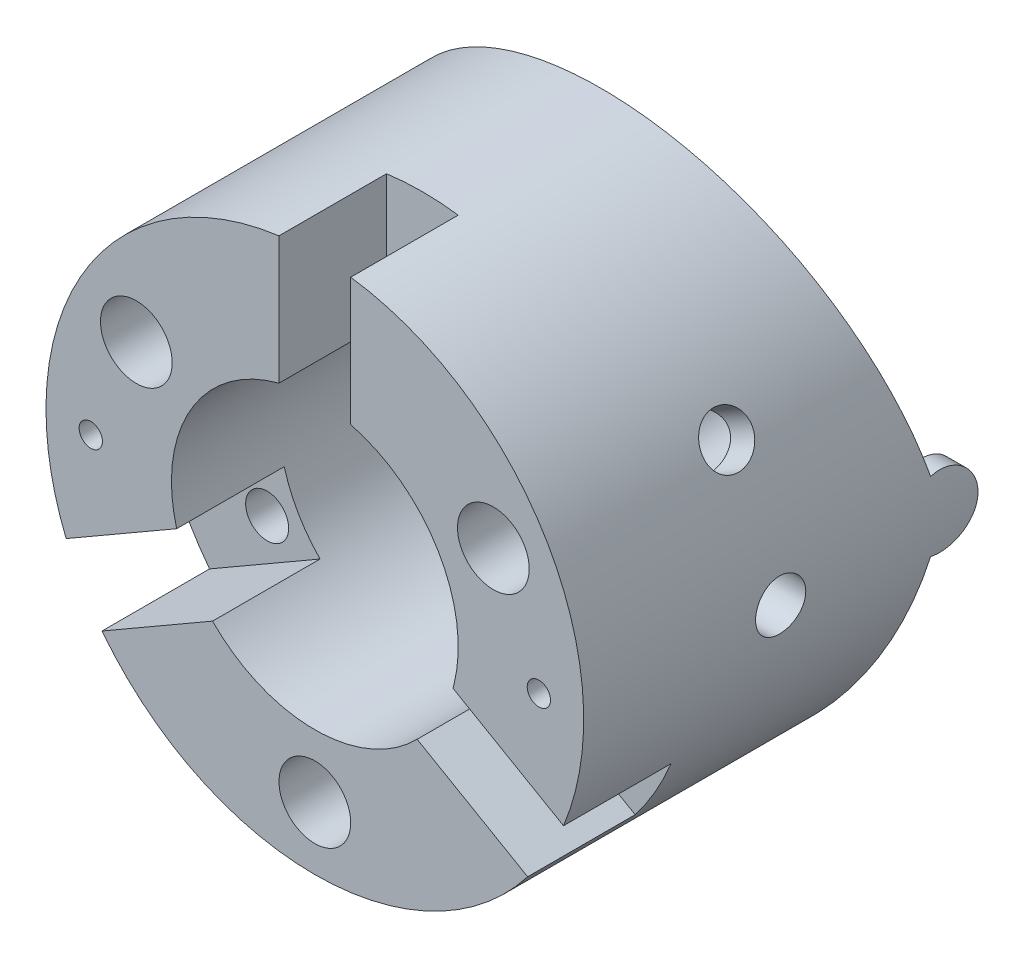
from build123d import *
from build123d.topology import SkipClean

# Parameters (mm, degrees)
SKETCH_1_R                       = 7.5
EXTRUDE_1_DEPTH                  = 10
SKETCH_2_R                       = 0.6
CUT_EXTRUDE_1_DEPTH              = 15.577379737
CUT_EXTRUDE_2_DEPTH              = 15.577379737
CUT_EXTRUDE_2_DEPTH_BACK         = 15.577379737
EXTRUDE_2_REACH                  = 16.577
EXTRUDE_2_END_RADIUS             = 7.5
SKETCH_4_R                       = 1
EXTRUDE_2_DIRECTION_2_REACH      = 16.577
EXTRUDE_2_DIRECTION_2_END_RADIUS = 7.5
SKETCH_5_R                       = 4
CUT_EXTRUDE_3_DEPTH              = 16.28070696
SKETCH_6_W                       = 2.5
SKETCH_6_H                       = 2
CUT_EXTRUDE_4_DEPTH              = 1
SKETCH_7_R                       = 0.325
CUT_EXTRUDE_5_DEPTH              = 16.28070696
SKETCH_8_W                       = 2
SKETCH_8_H                       = 5
CUT_EXTRUDE_6_DEPTH              = 3
CUT_EXTRUDE_7_REACH              = 18.077
CUT_EXTRUDE_7_START_RADIUS       = 7.5
CUT_EXTRUDE_7_END_RADIUS         = 7.5
SKETCH_9_R                       = 0.7
SKETCH_10_R                      = 1
CUT_EXTRUDE_8_DEPTH              = 16.28070696
CUT_EXTRUDE_9_DEPTH              = 1.25
SKETCH_13_R                      = 0.7
CUT_EXTRUDE_10_DEPTH             = 1.5
PATTERN_CIRCULAR_1_COUNT         = 3


with BuildPart() as part:
    # 草图1 → 凸台-拉伸1 (new body)
    with BuildSketch(Plane.XY):
        Circle(SKETCH_1_R)
    extrude(amount=EXTRUDE_1_DEPTH)

    # 草图2 → 切除-拉伸1 (cut, through all)
    with BuildSketch(Plane.XY.offset(10)):
        with Locations((0, 5)):
            Circle(SKETCH_2_R)
        with Locations((4.330127019, -2.5)):
            Circle(SKETCH_2_R)
        with Locations((-4.330127019, -2.5)):
            Circle(SKETCH_2_R)
    extrude(amount=-CUT_EXTRUDE_1_DEPTH, mode=Mode.SUBTRACT)

    # 草图3 → 切除-拉伸2 (cut, two sides: drawn at the far end of the back side and taken through both)
    with BuildSketch(Plane(origin=(0, 0, 0), x_dir=(0, 0, -1), z_dir=(1, 0, 0)).offset(-CUT_EXTRUDE_2_DEPTH_BACK)):
        Polygon((-2.009618943, 7.5), (0, 0), (0, 7.5), align=None)
        Polygon((0, -7.5), (0, 0), (-2.009618943, -7.5), align=None)
    extrude(amount=CUT_EXTRUDE_2_DEPTH + CUT_EXTRUDE_2_DEPTH_BACK, mode=Mode.SUBTRACT)

    # 凸台-拉伸2: up to this cylinder (the profile starts inside it)
    with SkipClean():  # the faces are left unmerged after this step: merging them gives an invalid solid
        extrude_2_end = Plane(origin=(0, 0, 0), z_dir=(0, 0, -1)) * Cylinder(EXTRUDE_2_END_RADIUS, 49.154, mode=Mode.PRIVATE)
        # 草图4 → 凸台-拉伸2 (add, up to the surface)
        with BuildSketch(Plane(origin=(0, 0, 0), x_dir=(0, 0, -1), z_dir=(1, 0, 0)), mode=Mode.PRIVATE) as extrude_2_sk1:
            Circle(SKETCH_4_R)
        extrude_2_tool1 = extrude(extrude_2_sk1.sketch, amount=EXTRUDE_2_REACH, mode=Mode.PRIVATE) & extrude_2_end
        add(extrude_2_tool1.solids().sort_by_distance((0, 0, 0))[0])
    add(part.part.scale(1), mode=Mode.REPLACE)  # the faces are merged on a copy

    # 凸台-拉伸2 direction 2: up to this cylinder (the profile starts inside it)
    extrude_2_direction_2_end = Plane(origin=(0, 0, 0), z_dir=(0, 0, -1)) * Cylinder(EXTRUDE_2_DIRECTION_2_END_RADIUS, 49.154, mode=Mode.PRIVATE)
    # 草图4 → 凸台-拉伸2 direction 2 (add, up to the surface)
    with BuildSketch(Plane(origin=(0, 0, 0), x_dir=(0, 0, -1), z_dir=(1, 0, 0)), mode=Mode.PRIVATE) as extrude_2_direction_2_sk1:
        Circle(SKETCH_4_R)
    extrude_2_direction_2_tool1 = extrude(extrude_2_direction_2_sk1.sketch, amount=-EXTRUDE_2_DIRECTION_2_REACH, mode=Mode.PRIVATE) & extrude_2_direction_2_end
    add(extrude_2_direction_2_tool1.solids().sort_by_distance((0, 0, 0))[0])

    # 草图5 → 切除-拉伸3 (cut, through all)
    with BuildSketch(Plane.XY.offset(10)):
        Circle(SKETCH_5_R)
    extrude(amount=-CUT_EXTRUDE_3_DEPTH, mode=Mode.SUBTRACT)

    # 草图6 → 切除-拉伸4 (cut)
    with BuildSketch(Plane(origin=(0, 0, -1), x_dir=(-1, 0, 0), z_dir=(0, 0, -1))):
        with Locations((-5.653018604, 0)):
            Rectangle(SKETCH_6_W, SKETCH_6_H)
        with Locations((5.653018604, 0)):
            Rectangle(SKETCH_6_W, SKETCH_6_H)
    extrude(amount=-CUT_EXTRUDE_4_DEPTH, mode=Mode.SUBTRACT)

    # 草图7 → 切除-拉伸5 (cut, through all)
    with BuildSketch(Plane.XY.offset(10)):
        with Locations((-6.25, 0)):
            Circle(SKETCH_7_R)
        with Locations((6.25, 0)):
            Circle(SKETCH_7_R)
    extrude(amount=-CUT_EXTRUDE_5_DEPTH, mode=Mode.SUBTRACT)

    # 草图8 → 切除-拉伸6 (cut)
    with BuildSketch(Plane.XY.offset(10)):
        Polygon((7.55916858, -3.209587476), (6.55916858, -4.941638284), (2.229041561, -2.441638284), (3.229041561, -0.709587476), align=None)
        with Locations((0, 5.65122576)):
            Rectangle(SKETCH_8_W, SKETCH_8_H)
        Polygon((-6.55916858, -4.941638284), (-7.55916858, -3.209587476), (-3.229041561, -0.709587476), (-2.229041561, -2.441638284), align=None)
    extrude(amount=-CUT_EXTRUDE_6_DEPTH, mode=Mode.SUBTRACT)

    # 切除-拉伸7: from a cylinder face, 18.077 long prism both ways, kept between that surface and its translate by the depth
    cut_extrude_7_start = Plane(origin=(0, 0, 4.504809), z_dir=(0, 0, -1)) * Cylinder(CUT_EXTRUDE_7_START_RADIUS, 52.154, mode=Mode.PRIVATE)
    cut_extrude_7_end = Plane(origin=(-1.5, 0, 4.504809), z_dir=(0, 0, -1)) * Cylinder(CUT_EXTRUDE_7_END_RADIUS, 52.154, mode=Mode.PRIVATE)
    # 草图9 → 切除-拉伸7 (cut, from a surface)
    with BuildSketch(Plane(origin=(0, 0, 0), x_dir=(0, 0, -1), z_dir=(1, 0, 0)), mode=Mode.PRIVATE) as cut_extrude_7_sk1:
        with Locations((-4.504809472, 0)):
            Circle(SKETCH_9_R)
    cut_extrude_7_tool1 = extrude(cut_extrude_7_sk1.sketch, amount=CUT_EXTRUDE_7_REACH, both=True, mode=Mode.PRIVATE)
    add(((cut_extrude_7_tool1 & cut_extrude_7_start) - cut_extrude_7_end).solids().sort_by_distance((0, 0, 1.004809))[0], mode=Mode.SUBTRACT)

    # 草图10 → 切除-拉伸8 (cut, through all)
    with BuildSketch(Plane.XY.offset(10)):
        with Locations((0, -5.75)):
            Circle(SKETCH_10_R)
        with Locations((-4.979646072, 2.875)):
            Circle(SKETCH_10_R)
        with Locations((4.979646072, 2.875)):
            Circle(SKETCH_10_R)
    extrude(amount=-CUT_EXTRUDE_8_DEPTH, mode=Mode.SUBTRACT)

    # 草图12 → 切除-拉伸9 (cut)
    with BuildSketch(Plane.ZY.offset(7.5)):
        with BuildLine():
            add(Edge.make_bspline(
                [(5.204809472, 0), (5.204809472, 0.051199712), (5.199123299, 0.102706789), (5.187959272, 0.152664175), (5.170841851, 0.229262126), (5.140242984, 0.303934373), (5.098731118, 0.370482223), (5.057291821, 0.436913739), (5.003838303, 0.49709013), (4.942769133, 0.546068983), (4.881930283, 0.594863116), (4.811862248, 0.63388345), (4.738295097, 0.659912466), (4.664722263, 0.685943493), (4.585626327, 0.699688858), (4.507550922, 0.699994632), (4.429176041, 0.700301578), (4.349661596, 0.6870711), (4.275636524, 0.661422528), (4.201493741, 0.63573317), (4.130798865, 0.596879853), (4.069396797, 0.548102), (4.00818437, 0.499474799), (3.954515592, 0.439647627), (3.912794265, 0.373521077), (3.871195874, 0.307589376), (3.840336855, 0.233584704), (3.822775946, 0.157576237), (3.805184147, 0.081434066), (3.800460387, 0.001183547), (3.809003142, -0.076508507), (3.81757805, -0.154492978), (3.839756643, -0.232061023), (3.873667996, -0.302754749), (3.907575872, -0.373441227), (3.954146449, -0.439216667), (4.009523931, -0.494663758), (4.064690561, -0.549899731), (4.130112804, -0.596407498), (4.200442957, -0.630365787), (4.270661085, -0.664269985), (4.347700702, -0.686588967), (4.425217626, -0.695460379), (4.502977447, -0.704359588), (4.583363984, -0.69996654), (4.659680471, -0.682652894), (4.736223158, -0.665287931), (4.810796065, -0.634447875), (4.877209646, -0.592720938), (4.943502788, -0.551069672), (5.003503142, -0.497425786), (5.052283161, -0.43620243), (5.100931035, -0.375144926), (5.139755919, -0.304869035), (5.165549195, -0.231134199), (5.191345167, -0.157391657), (5.204809472, -0.078157304), (5.204809472, 0)],
                knots=[0, 0, 0, 0, 0.034789634, 0.034789634, 0.034789634, 0.088576238, 0.088576238, 0.088576238, 0.142262726, 0.142262726, 0.142262726, 0.195742678, 0.195742678, 0.195742678, 0.249231006, 0.249231006, 0.249231006, 0.302930553, 0.302930553, 0.302930553, 0.356713801, 0.356713801, 0.356713801, 0.410324283, 0.410324283, 0.410324283, 0.463775505, 0.463775505, 0.463775505, 0.517326778, 0.517326778, 0.517326778, 0.5710837, 0.5710837, 0.5710837, 0.624830794, 0.624830794, 0.624830794, 0.678367318, 0.678367318, 0.678367318, 0.731820201, 0.731820201, 0.731820201, 0.785447328, 0.785447328, 0.785447328, 0.839234696, 0.839234696, 0.839234696, 0.892918367, 0.892918367, 0.892918367, 0.946454262, 0.946454262, 0.946454262, 1, 1, 1, 1], degree=3))
        make_face()
    extrude(amount=-CUT_EXTRUDE_9_DEPTH, mode=Mode.SUBTRACT)

    # 草图13 → 切除-拉伸10 (cut)
    with BuildSketch(Plane(origin=(-6.495190528, 3.75, 0), x_dir=(0, 0, -1), z_dir=(-0.866025403784438, 0.500000000000001, 0))):
        with Locations((-5, 0)):
            Circle(SKETCH_13_R)
    cut_extrude_10 = extrude(amount=-CUT_EXTRUDE_10_DEPTH, mode=Mode.SUBTRACT)

    # 阵列(圆周)1: 切除-拉伸10 ×3 about axis
    pattern_circular_1_axis = Axis((0, 0, 10), (0, 0, 1))
    for i in range(1, PATTERN_CIRCULAR_1_COUNT):
        add(cut_extrude_10.rotate(pattern_circular_1_axis, i * 360 / PATTERN_CIRCULAR_1_COUNT), mode=Mode.SUBTRACT)


solid = part.part
